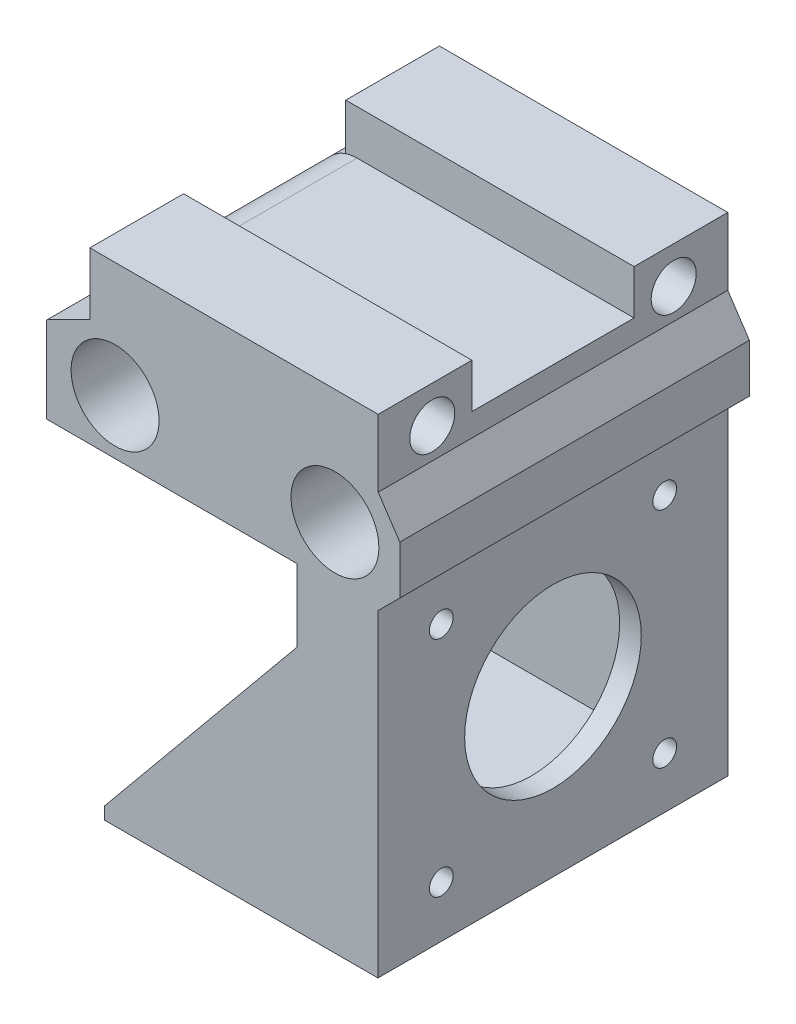
from build123d import *
from build123d.topology import SkipClean

# Parameters (mm, degrees)
SKETCH1_W            = 42.5
SKETCH1_H            = 55.85
BOSS_EXTRUDE2_DEPTH  = 42.5
SKETCH5_R            = 3.175
CUT_EXTRUDE2_DEPTH   = 42.5
SKETCH6_W            = 42.5
SKETCH6_H            = 42.5
CUT_EXTRUDE3_DEPTH   = 39.5
SKETCH7_R            = 12.25
SKETCH7_R_2          = 1.65
CUT_EXTRUDE4_DEPTH   = 39.5
SKETCH9_W            = 10
SKETCH9_H            = 42.5
CUT_EXTRUDE5_DEPTH   = 39.5
CHAMFER1_SIZE        = 3
CHAMFER2_SIZE        = 2
SKETCH10_W           = 3
SKETCH10_H           = 2.12759362
BOSS_EXTRUDE3_DEPTH  = 3
SKETCH12_W           = 3
SKETCH12_H           = 3
BOSS_EXTRUDE4_DEPTH  = 3
BOSS_EXTRUDE5_DEPTH  = 2
BOSS_EXTRUDE6_DEPTH  = 2
SKETCH16_W           = 9
SKETCH16_H           = 14.17
SKETCH16_R           = 3.125
BOSS_EXTRUDE8_DEPTH  = 5
SKETCH18_W           = 9
SKETCH18_H           = 12.353282928
BOSS_EXTRUDE9_DEPTH  = 2
SKETCH20_W           = 0.494527866
SKETCH20_H           = 3.5
BOSS_EXTRUDE10_DEPTH = 0.2
BOSS_EXTRUDE11_DEPTH = 42.5
BOSS_EXTRUDE12_DEPTH = 48.5
CUT_EXTRUDE8_DEPTH   = 54.5
BOSS_EXTRUDE15_DEPTH = 3
BOSS_EXTRUDE16_DEPTH = 3
BOSS_EXTRUDE17_DEPTH = 1
BOSS_EXTRUDE19_DEPTH = 3
BOSS_EXTRUDE20_DEPTH = 1
BOSS_EXTRUDE21_START = -3
SKETCH34_R           = 3.175
BOSS_EXTRUDE21_DEPTH = 3
SKETCH35_R           = 3.175
BOSS_EXTRUDE22_DEPTH = 3
BOSS_EXTRUDE23_DEPTH = 3
BOSS_EXTRUDE24_DEPTH = 3
CUT_EXTRUDE10_DEPTH  = 1
SKETCH41_W           = 48.5
SKETCH41_H           = 4.770205393
BOSS_EXTRUDE25_DEPTH = 1.3
CHAMFER3_SIZE        = 1.5
SKETCH44_W           = 1
SKETCH44_H           = 12.353282928
BOSS_EXTRUDE26_DEPTH = 7
SKETCH45_W           = 13
SKETCH45_H           = 8.5
SKETCH45_R           = 3.125
SKETCH45_H_2         = 13.67
BOSS_EXTRUDE27_DEPTH = 40
SKETCH46_R           = 3.125
CUT_EXTRUDE11_DEPTH  = 49
CUT_EXTRUDE12_DEPTH  = 68
CUT_EXTRUDE13_DEPTH  = 68
SKETCH49_W           = 2.643980288
SKETCH49_H           = 1.166461892
CUT_EXTRUDE14_DEPTH  = 68
BOSS_EXTRUDE28_DEPTH = 13
BOSS_EXTRUDE29_DEPTH = 48.5
SKETCH53_W           = 2
SKETCH53_H           = 11.22240638
BOSS_EXTRUDE30_DEPTH = 48.5
CHAMFER4_SIZE        = 2
SKETCH57_W           = 22.5
SKETCH57_H           = 6.176641464
BOSS_EXTRUDE32_DEPTH = 46
BOSS_EXTRUDE33_DEPTH = 48.5
BOSS_EXTRUDE35_DEPTH = 48.5
SKETCH55_R           = 6.1
CUT_EXTRUDE15_DEPTH  = 48.5
BOSS_EXTRUDE36_DEPTH = 48.5
SKETCH62_W           = 48.5
SKETCH62_H           = 0.4
CUT_EXTRUDE16_DEPTH  = 48.5
CHAMFER5_SIZE        = 5.5
FILLET1_R            = 5
CUT_EXTRUDE17_DEPTH  = 1
BOSS_EXTRUDE37_DEPTH = 48.5


# Some blends are built 0.0001 mm under size
with BuildPart() as part:
    # Sketch1 → Boss-Extrude2 (new body)
    with BuildSketch(Plane.XY):
        with Locations((-16.653499003, 3.960644895)):
            Rectangle(SKETCH1_W, SKETCH1_H)
    extrude(amount=BOSS_EXTRUDE2_DEPTH)

    # Sketch5 → Cut-Extrude2 (cut)
    with BuildSketch(Plane.XY.offset(42.5)):
        with Locations((-31.903499003, 25.965832134)):
            Circle(SKETCH5_R)
        with Locations(Location((-1.403499003, 25.965832134, 0), (0, 0, 180))):
            Circle(SKETCH5_R)
    extrude(amount=-CUT_EXTRUDE2_DEPTH, mode=Mode.SUBTRACT)

    # Sketch6 → Cut-Extrude3 (cut)
    with BuildSketch(Plane.ZY.offset(37.903499003)):
        with Locations((21.25, -0.586761485)):
            Rectangle(SKETCH6_W, SKETCH6_H)
    extrude(amount=-CUT_EXTRUDE3_DEPTH, mode=Mode.SUBTRACT)

    # Sketch7 → Cut-Extrude4 (cut)
    with BuildSketch(Plane(origin=(4.596500997, 0, 0), x_dir=(0, 0, -1), z_dir=(1, 0, 0))):
        with Locations((-21.25, -0.586761485)):
            Circle(SKETCH7_R)
        with Locations((-36.75, -16.336761485)):
            Circle(SKETCH7_R_2)
        with Locations((-5.75, -16.336761485)):
            Circle(SKETCH7_R_2)
        with Locations((-36.75, 14.663238515)):
            Circle(SKETCH7_R_2)
        with Locations((-5.75, 14.663238515)):
            Circle(SKETCH7_R_2)
    extrude(amount=-CUT_EXTRUDE4_DEPTH, mode=Mode.SUBTRACT)

    # Sketch9 → Cut-Extrude5 (cut)
    with BuildSketch(Plane.XZ.offset(23.964355105)):
        with Locations((-32.903499003, 21.25)):
            Rectangle(SKETCH9_W, SKETCH9_H)
    extrude(amount=-CUT_EXTRUDE5_DEPTH, mode=Mode.SUBTRACT)

    # Chamfer1
    chamfer1_edges = [part.edges().sort_by_distance(p)[0] for p in [
        (-37.903499003, 20.663238515, 21.25),
        (-37.903499003, 31.885644895, 21.25),
    ]]
    chamfer(chamfer1_edges, length=CHAMFER1_SIZE)

    # Chamfer2
    chamfer2_edges = [part.edges().sort_by_distance(p)[0] for p in [
        (4.596500997, -23.964355105, 21.25),
    ]]
    chamfer(chamfer2_edges, length=CHAMFER2_SIZE)

    # Sketch10 → Boss-Extrude3 (add)
    with BuildSketch(Plane.ZY.offset(27.903499003)):
        with Locations((44, -22.900558295)):
            Rectangle(SKETCH10_W, SKETCH10_H)
        with Locations((-1.5, -22.900558295)):
            Rectangle(SKETCH10_W, SKETCH10_H)
    extrude(amount=-BOSS_EXTRUDE3_DEPTH)

    # Sketch12 → Boss-Extrude4 (add)
    with BuildSketch(Plane.ZY.offset(-1.596500997)):
        with Locations((44, 19.163238515)):
            Rectangle(SKETCH12_W, SKETCH12_H)
        with Locations((-1.5, 19.163238515)):
            Rectangle(SKETCH12_W, SKETCH12_H)
    extrude(amount=-BOSS_EXTRUDE4_DEPTH)

    # Sketch13 → Boss-Extrude5 (add)
    with BuildSketch(Plane(origin=(0, 0, -3), x_dir=(-1, 0, 0), z_dir=(0, 0, -1))):
        Polygon((-1.596500997, 17.663238515), (24.903499003, -21.836761485), (27.903499003, -21.836761485), (-1.596500997, 20.663238515), align=None)
    extrude(amount=-BOSS_EXTRUDE5_DEPTH)

    # Sketch14 → Boss-Extrude6 (add)
    with BuildSketch(Plane.XY.offset(45.5)):
        Polygon((1.596500997, 17.663238515), (-24.903499003, -21.836761485), (-27.903499003, -21.836761485), (1.596500997, 20.663238515), align=None)
    extrude(amount=-BOSS_EXTRUDE6_DEPTH)

    # Sketch16 → Boss-Extrude8 (add)
    # profile 1 of 2: a face of its own
    with BuildSketch(Plane(origin=(4.596500997, 0, 0), x_dir=(0, 0, -1), z_dir=(1, 0, 0))):
        with Locations((-38, 37.153927823)):
            Rectangle(SKETCH16_W, SKETCH16_H)
        with Locations((-38, 39.113927823)):
            Circle(SKETCH16_R, mode=Mode.SUBTRACT)
    # profile 2 of 2: a face of its own
    with BuildSketch(Plane(origin=(4.596500997, 0, 0), x_dir=(0, 0, -1), z_dir=(1, 0, 0))):
        with Locations((-4.5, 37.153927823)):
            Rectangle(SKETCH16_W, SKETCH16_H)
        with Locations(Location((-4.5, 39.113927823, 0), (0, 0, 180))):
            Circle(SKETCH16_R, mode=Mode.SUBTRACT)
    extrude(amount=-BOSS_EXTRUDE8_DEPTH)

    # Sketch18 → Boss-Extrude9 (add)
    with BuildSketch(Plane.ZY.offset(0.403499003)):
        with Locations((4.5, 38.062286359)):
            Rectangle(SKETCH18_W, SKETCH18_H)
        with Locations((38, 38.062286359)):
            Rectangle(SKETCH18_W, SKETCH18_H)
    extrude(amount=BOSS_EXTRUDE9_DEPTH)

    # Sketch20 → Boss-Extrude10 (add)
    with BuildSketch(Plane.XZ.offset(23.964355105)):
        with Locations((-12.40623507, 23)):
            Rectangle(SKETCH20_W, SKETCH20_H)
    extrude(amount=BOSS_EXTRUDE10_DEPTH)

    # Sketch22 → Boss-Extrude11 (add)
    with BuildSketch(Plane.XY.offset(42.5)):
        Polygon((-27.903499003, -23.964355105), (-27.903499003, -24.964355105), (4.596500997, -24.964355105), (4.596500997, -21.964355105), (2.596500997, -23.964355105), align=None)
    extrude(amount=-BOSS_EXTRUDE11_DEPTH)

    # Sketch23 → Boss-Extrude12 (add)
    with BuildSketch(Plane.XY.offset(45.5)):
        Polygon((1.596500997, -21.836761485), (-33.403499003, -21.836761485), (-33.403499003, -24.836761485), (1.596500997, -24.964355105), align=None)
    extrude(amount=-BOSS_EXTRUDE12_DEPTH)

    # Sketch24 → Cut-Extrude8 (cut)
    with BuildSketch(Plane.XY.offset(45.5)):
        Polygon((-27.903499003, -24.856811911), (-27.903499003, -24.964355105), (1.596500997, -24.964355105), align=None)
    extrude(amount=-CUT_EXTRUDE8_DEPTH, mode=Mode.SUBTRACT)

    # Sketch28 → Boss-Extrude15 (add)
    with BuildSketch(Plane(origin=(-0.090985928, -24.958203317, 0), x_dir=(0.9999933551145118, -0.0036455077591437566, 0), z_dir=(-0.0036455077591437566, -0.9999933551145118, 0))):
        Polygon((-33.312734433, 45.5), (-33.312734433, -3), (1.687498139, -3), (4.687478204, -3), (4.687478204, 0), (4.687478204, 42.5), (4.687478204, 45.5), (1.532098916, 45.5), align=None)
    extrude(amount=-BOSS_EXTRUDE15_DEPTH)

    # Sketch30 → Boss-Extrude16 (add)
    with BuildSketch(Plane.XY.offset(45.5)):
        Polygon((4.596500997, 20.663238515), (1.596500997, 20.663238515), (-33.403499003, -21.836761485), (-33.403499003, -24.836761485), (4.596461128, -24.975291555), align=None)
    extrude(amount=-BOSS_EXTRUDE16_DEPTH)

    # Sketch31 → Boss-Extrude17 (add)
    with BuildSketch(Plane(origin=(4.596500997, 0, 0), x_dir=(0, 0, -1), z_dir=(1, 0, 0))):
        Polygon((-45.5, 20.663238515), (-40.56451316, 20.663238515), (-40.56451316, -21.975271766), (-45.5, -21.836761485), align=None)
    extrude(amount=-BOSS_EXTRUDE17_DEPTH)

    # Sketch32 → Boss-Extrude19 (add)
    with BuildSketch(Plane(origin=(0, 0, -3), x_dir=(-1, 0, 0), z_dir=(0, 0, -1))):
        Polygon((-4.596500997, 20.663238515), (-4.596461128, -24.975291555), (33.403499003, -24.836761485), (33.403499003, -21.836761485), (-1.596500997, 20.663238515), align=None)
    extrude(amount=-BOSS_EXTRUDE19_DEPTH)

    # Sketch33 → Boss-Extrude20 (add)
    with BuildSketch(Plane(origin=(4.596500997, 0, 0), x_dir=(0, 0, -1), z_dir=(1, 0, 0))):
        Polygon((3, 20.663238515), (-2.503573256, 20.663238515), (-2.503573256, -21.97531149), (3, -21.97527163), align=None)
    extrude(amount=-BOSS_EXTRUDE20_DEPTH)

    # Sketch34 → Boss-Extrude21 (add)
    with BuildSketch(Plane(origin=(0, 0, -3), x_dir=(-1, 0, 0), z_dir=(0, 0, -1)).offset(BOSS_EXTRUDE21_START)):
        Polygon((-4.596500997, 20.663238515), (34.903499003, 20.663238515), (37.903499003, 23.663238515), (37.903499003, 28.885644895), (34.903499003, 31.885644895), (2.403499003, 31.885644895), (2.403499003, 44.238927823), (-4.596500997, 44.238927823), align=None)
        with Locations((1.403499003, 25.965832134)):
            Circle(SKETCH34_R, mode=Mode.SUBTRACT)
        with Locations(Location((31.903499003, 25.965832134, 0), (0, 0, 180))):
            Circle(SKETCH34_R, mode=Mode.SUBTRACT)
    extrude(amount=BOSS_EXTRUDE21_DEPTH)

    # Sketch35 → Boss-Extrude22 (add)
    with BuildSketch(Plane.XY.offset(45.5)):
        Polygon((4.596500997, 20.663238515), (4.596500997, 44.238927823), (-2.403499003, 44.238927823), (-2.403499003, 31.885644895), (-34.903499003, 31.885644895), (-37.903499003, 28.885644895), (-37.903499003, 23.663238515), (-34.903499003, 20.663238515), align=None)
        with Locations((-31.903499003, 25.965832134)):
            Circle(SKETCH35_R, mode=Mode.SUBTRACT)
        with Locations((-1.403499003, 25.965832134)):
            Circle(SKETCH35_R, mode=Mode.SUBTRACT)
    extrude(amount=-BOSS_EXTRUDE22_DEPTH)

    # Sketch36 → Boss-Extrude23 (add)
    with BuildSketch(Plane(origin=(0, 0, -3), x_dir=(-1, 0, 0), z_dir=(0, 0, -1))):
        Polygon((-1.596500997, 20.663238515), (6.63879312, 10.663238515), (6.63879312, 20.663238515), align=None)
    extrude(amount=-BOSS_EXTRUDE23_DEPTH)

    # Sketch37 → Boss-Extrude24 (add)
    with BuildSketch(Plane.XY.offset(45.5)):
        Polygon((-6.63879312, 20.663238515), (-6.63879312, 10.663238515), (1.596500997, 20.663238515), align=None)
    extrude(amount=-BOSS_EXTRUDE24_DEPTH)

    # Sketch40 → Cut-Extrude10 (cut)
    with BuildSketch(Plane(origin=(4.687447057, -0.017088238, 0), x_dir=(0, 0, -1), z_dir=(0.9999933551145119, -0.003645507759143759, 0))):
        Polygon((-45.5, -21.819859802), (-45.5, -24.958369162), (3, -24.958369162), (3, -21.958369162), align=None)
    extrude(amount=-CUT_EXTRUDE10_DEPTH, mode=Mode.SUBTRACT)

    # Sketch41 → Boss-Extrude25 (add)
    with BuildSketch(Plane(origin=(4.596500997, 0, 0), x_dir=(0, 0, -1), z_dir=(1, 0, 0))):
        with Locations((-21.25, -22.586543351)):
            Rectangle(SKETCH41_W, SKETCH41_H)
    extrude(amount=-BOSS_EXTRUDE25_DEPTH)

    # Chamfer3
    # the kernel refuses this chamfer: 1.5 mm, written as the material it takes off along each edge
    with BuildSketch(Plane(origin=(4.596500997, -24.971646047, 49.357524482), x_dir=(0.02749587661058619, 0.9996219169112968, 0), z_dir=(0, 0, -1))) as chamfer3_piece_1:
        Polygon((CHAMFER3_SIZE * 0.999621916911, -CHAMFER3_SIZE * 0.0274958766106), (-CHAMFER3_SIZE * 0.0274958766106, -CHAMFER3_SIZE * 0.999621916911), (0, 0), align=None)
    extrude(amount=56.215048964, mode=Mode.SUBTRACT)

    # Sketch44 → Boss-Extrude26 (add)
    with BuildSketch(Plane(origin=(4.596500997, 0, 0), x_dir=(0, 0, -1), z_dir=(1, 0, 0))):
        with Locations((-33, 38.062286359)):
            Rectangle(SKETCH44_W, SKETCH44_H)
        with Locations((-9.5, 38.062286359)):
            Rectangle(SKETCH44_W, SKETCH44_H)
    extrude(amount=-BOSS_EXTRUDE26_DEPTH)

    # Sketch45 → Boss-Extrude27 (add)
    # profile 1 of 2: a face of its own
    with BuildSketch(Plane(origin=(4.596500997, 0, 0), x_dir=(0, 0, -1), z_dir=(1, 0, 0))):
        with Locations((-39, 39.988927823)):
            Rectangle(SKETCH45_W, SKETCH45_H)
        with Locations((-38, 39.113927823)):
            Circle(SKETCH45_R, mode=Mode.SUBTRACT)
    # profile 2 of 2: a face of its own
    with BuildSketch(Plane(origin=(4.596500997, 0, 0), x_dir=(0, 0, -1), z_dir=(1, 0, 0))):
        with Locations((-3.5, 37.403927823)):
            Rectangle(SKETCH45_W, SKETCH45_H_2)
        with Locations(Location((-4.5, 39.113927823, 0), (0, 0, 180))):
            Circle(SKETCH45_R, mode=Mode.SUBTRACT)
    extrude(amount=-BOSS_EXTRUDE27_DEPTH)

    # Sketch46 → Cut-Extrude11 (cut)
    with BuildSketch(Plane(origin=(4.596500997, 0, 0), x_dir=(0, 0, -1), z_dir=(1, 0, 0))):
        with Locations((-38, 39.113927823)):
            Circle(SKETCH46_R)
        with Locations((-4.5, 39.113927823)):
            Circle(SKETCH46_R)
    extrude(amount=-CUT_EXTRUDE11_DEPTH, mode=Mode.SUBTRACT)

    # Sketch47 → Cut-Extrude12 (cut)
    with BuildSketch(Plane.ZY.offset(33.403499003)):
        Polygon((-3, -24.903295754), (-3, -23.903295754), (45.5, -23.903295754), (45.5, -24.836761485), align=None)
    extrude(amount=-CUT_EXTRUDE12_DEPTH, mode=Mode.SUBTRACT)


with BuildPart() as cut_extrude12_piece_1:
    # of the separate pieces the step leaves, piece 1, a body of its own (cut_extrude12_pieces)
    add(part.part.solids().sort_by_distance((4.596500997, 44.238927823, 32.5))[0])

    # Sketch51 → Boss-Extrude28 (add)
    with BuildSketch(Plane.XY.offset(45.5)):
        Polygon((-35.403499003, 35.738927823), (-35.403499003, 31.385644895), (-34.903499003, 31.885644895), (-2.403499003, 31.885644895), (-2.403499003, 35.738927823), align=None)
    extrude(amount=-BOSS_EXTRUDE28_DEPTH)

    # Sketch52 → Boss-Extrude29 (add)
    with BuildSketch(Plane.XY.offset(45.5)):
        Polygon((-41.403499003, 20.663238515), (-34.903499003, 20.663238515), (-37.903499003, 23.663238515), (-37.903499003, 28.885644895), (-35.403499003, 31.385644895), (-35.403499003, 32.640472598), (-41.403499003, 32.640472598), align=None)
    extrude(amount=-BOSS_EXTRUDE29_DEPTH)

    # Sketch53 → Boss-Extrude30 (add)
    with BuildSketch(Plane.XY.offset(45.5)):
        with Locations((5.596500997, 26.274441705)):
            Rectangle(SKETCH53_W, SKETCH53_H)
    extrude(amount=-BOSS_EXTRUDE30_DEPTH)

    # Chamfer4
    chamfer4_edges = [cut_extrude12_piece_1.edges().sort_by_distance(p)[0] for p in [
        (6.596500997, 20.663238515, 21.25),
        (6.596500997, 31.885644895, 21.25),
    ]]
    chamfer(chamfer4_edges, length=CHAMFER4_SIZE - 0.0001)  # a hair under: the kernel refuses the full size

    # Sketch57 → Boss-Extrude32 (add)
    with BuildSketch(Plane(origin=(4.596500997, 0, 0), x_dir=(0, 0, -1), z_dir=(1, 0, 0))):
        with Locations((-21.25, 34.973965627)):
            Rectangle(SKETCH57_W, SKETCH57_H)
    extrude(amount=-BOSS_EXTRUDE32_DEPTH)

    # Sketch58 → Boss-Extrude33 (add)
    with BuildSketch(Plane.XY.offset(45.5)):
        Polygon((4.596500997, 31.885644895), (6.596500997, 29.885644895), (6.596500997, 31.885644895), align=None)
    extrude(amount=-BOSS_EXTRUDE33_DEPTH)

    # Sketch60 → Boss-Extrude35 (add)
    with BuildSketch(Plane.XY.offset(45.5)):
        Polygon((-35.403499003, 35.640472598), (-41.403499003, 32.640472598), (-35.403499003, 32.640472598), align=None)
    extrude(amount=-BOSS_EXTRUDE35_DEPTH)

    # Sketch55 → Cut-Extrude15 (cut)
    with BuildSketch(Plane.XY.offset(45.5)):
        with Locations((-31.903499003, 28.263238515)):
            Circle(SKETCH55_R)
        with Locations((-1.403499003, 28.263238515)):
            Circle(SKETCH55_R)
    extrude(amount=-CUT_EXTRUDE15_DEPTH, mode=Mode.SUBTRACT)

    # Sketch61 → Boss-Extrude36 (add)
    with BuildSketch(Plane.XY.offset(45.5)):
        Polygon((4.596500997, 31.885644895), (6.596500997, 31.885644895), (4.596500997, 34.885644895), align=None)
    extrude(amount=-BOSS_EXTRUDE36_DEPTH)

    # Sketch62 → Cut-Extrude16 (cut)
    with BuildSketch(Plane.ZY.offset(33.403499003)):
        with Locations((21.25, -23.703295754)):
            Rectangle(SKETCH62_W, SKETCH62_H)
    extrude(amount=-CUT_EXTRUDE16_DEPTH, mode=Mode.SUBTRACT)

    # Chamfer5
    chamfer5_edges = [cut_extrude12_piece_1.edges().sort_by_distance(p)[0] for p in [
        (-41.403499003, 38.062286359, 21.25),
    ]]
    chamfer(chamfer5_edges, length=CHAMFER5_SIZE)

    # Fillet1
    # the kernel refuses this fillet: 5 mm, written as the material it takes off along each edge
    with BuildSketch(Plane(origin=(-35.903499003, 38.062286359, 10), x_dir=(-0.7071067811865476, -0.7071067811865476, 0), z_dir=(0, 0, 1))) as fillet1_piece_1:
        with BuildLine():
            CenterArc((FILLET1_R * 0.414213562373, FILLET1_R), FILLET1_R, 225, 45)
            Line((-FILLET1_R * 0.292893218813, FILLET1_R * 0.292893218813), (0, 0))
            Line((0, 0), (FILLET1_R * 0.414213562373, 0))
        make_face()
    extrude(amount=22.5, mode=Mode.SUBTRACT)

    # Sketch65 → Cut-Extrude17 (cut)
    with BuildSketch(Plane.XZ.offset(23.503295754)):
        Polygon((-14.419323856, 16.25), (-18.919323856, 16.25), (-18.919323856, 26.25), (-9.919323856, 26.25), (-9.919323856, 16.25), align=None)
    extrude(amount=-CUT_EXTRUDE17_DEPTH, mode=Mode.SUBTRACT)

    # Sketch67 → Boss-Extrude37 (add)
    with SkipClean():  # the faces are left unmerged after this step: merging them gives an invalid solid
        with BuildSketch(Plane.XY.offset(45.5)):
            Polygon((6.596500997, 31.885644895), (7.596500997, 30.385644895), (7.596500997, 23.663238515), (6.596500997, 22.663238515), align=None)
        extrude(amount=-BOSS_EXTRUDE37_DEPTH)


with BuildPart() as cut_extrude12_piece_2:
    # of the separate pieces the step leaves, piece 2, a body of its own (cut_extrude12_pieces)
    add(part.part.solids().sort_by_distance((3.23138556, -24.836761485, 45.5))[0])

    # Sketch48 → Cut-Extrude13 (cut)
    with BuildSketch(Plane.ZY.offset(33.403499003)):
        Polygon((-2.929774612, -24.185457139), (-2.929774612, -25.519392631), (45.758870815, -25.786179729), (45.758870815, -24.185457139), align=None)
    extrude(amount=-CUT_EXTRUDE13_DEPTH, mode=Mode.SUBTRACT)

    # Sketch49 → Cut-Extrude14 (cut)
    with BuildSketch(Plane.ZY.offset(33.403499003)):
        with Locations((-2.157001957, -24.67821455)):
            Rectangle(SKETCH49_W, SKETCH49_H)
    extrude(amount=-CUT_EXTRUDE14_DEPTH, mode=Mode.SUBTRACT)


solid = cut_extrude12_piece_1.part
